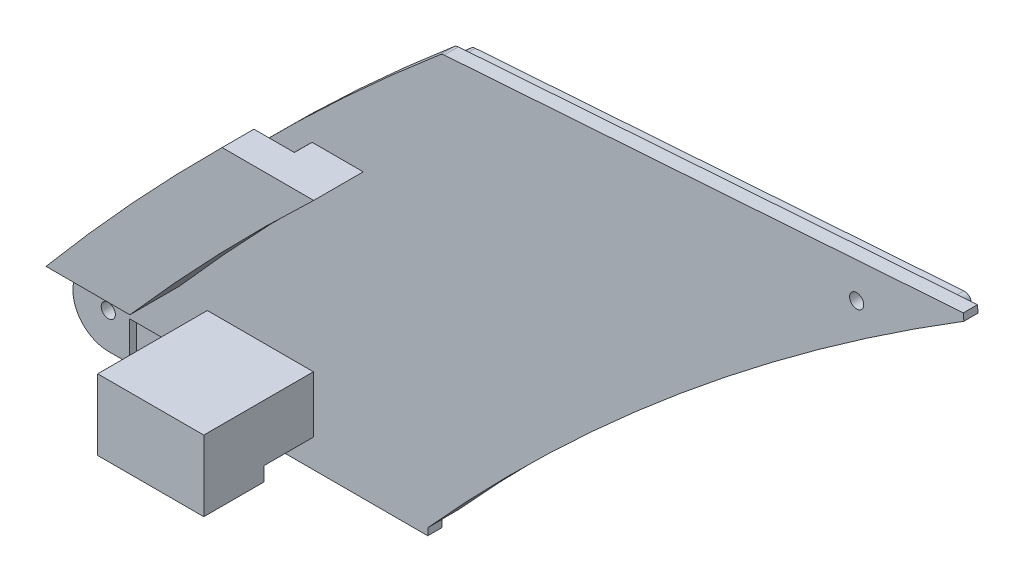
from build123d import *

# Parameters (mm, degrees)
BOSS_EXTRUDE2_DEPTH         = 2
SKETCH7_R                   = 1
BOSS_EXTRUDE3_DEPTH         = 2
FILLET1_R                   = 2
SKETCH8_W                   = 15
SKETCH8_H                   = 8
BOTTOM_SCREWHOLE_PEG_DEPTH  = 15.5
SKETCH12_W                  = 15
SKETCH12_H                  = 8.5
BOTTOM_CLIP_DEPTH           = 2
SKETCH9_W                   = 9
SKETCH9_H                   = 5.5
BUMPER_FEATURE_CUTOUT_DEPTH = 1
FRONT_CLIP_PEG_DEPTH        = 7
FRONT_START                 = -4.5
FRONT_CLIP_DEPTH            = 4.5


with BuildPart() as part:
    # Sketch6 → Boss-Extrude2 (new body)
    with BuildSketch(Plane.XY.offset(2)):
        with BuildLine():
            Line((-47.16876351, -59), (-2.443648629, -59))
            ThreePointArc((-2.443648629, -59), (-2.038405947, -58.914209149), (-1.702695493, -58.671556736))
            ThreePointArc((-1.702695493, -58.671556736), (32.301028127, -25.886609728), (70.398776732, 2.035917408))
            ThreePointArc((70.398776732, 2.035917408), (70.813266743, 3.192601161), (69.793484422, 3.877993962))
            Line((69.793484422, 3.877993962), (0.723267865, -0.951866082))
            ThreePointArc((0.723267865, -0.951866082), (0.415830952, -1.023295613), (0.145969905, -1.186986325))
            ThreePointArc((0.145969905, -1.186986325), (-26.215640884, -25.687788129), (-50.262327585, -52.46428288))
            ThreePointArc((-50.262327585, -52.46428288), (-50.784207361, -56.711305279), (-47.16876351, -59))
        make_face()
        with BuildLine():
            Line((-47.16876351, -58), (-2.443648629, -58))
            ThreePointArc((-2.443648629, -58), (31.656951696, -25.121648584), (69.863240895, 2.880429912))
            Line((69.863240895, 2.880429912), (0.793024339, -1.949430132))
            ThreePointArc((0.793024339, -1.949430132), (-25.502517251, -26.388826418), (-49.488936566, -53.09821216))
            ThreePointArc((-49.488936566, -53.09821216), (-49.880346398, -56.28347896), (-47.16876351, -58))
        make_face(mode=Mode.SUBTRACT)
    extrude(amount=BOSS_EXTRUDE2_DEPTH)

    # Sketch7 → Boss-Extrude3 (add)
    with BuildSketch(Plane.XY.offset(4)):
        with BuildLine():
            Line((73.71668331, 5.154772651), (0.326528995, 0.022833132))
            ThreePointArc((0.326528995, 0.022833132), (0.019473004, -0.048441349), (-0.250141607, -0.211755142))
            ThreePointArc((-0.250141607, -0.211755142), (-26.813414366, -24.869459397), (-51.035718603, -51.8303536))
            ThreePointArc((-51.035718603, -51.8303536), (-51.688068324, -57.139131599), (-47.16876351, -60))
            Line((-47.16876351, -60), (-2, -60))
            Line((-2, -60), (-2, -59))
            ThreePointArc((-2, -59), (33.663262979, -24.745525454), (73.786439783, 4.157208601))
            Line((73.786439783, 4.157208601), (73.71668331, 5.154772651))
        make_face()
        with Locations((58.629217017, -0.912455258)):
            Circle(SKETCH7_R, mode=Mode.SUBTRACT)
        with Locations((-47.16876351, -55)):
            Circle(SKETCH7_R, mode=Mode.SUBTRACT)
    extrude(amount=BOSS_EXTRUDE3_DEPTH)

    # Fillet1
    fillet1_edges = [part.edges().sort_by_distance(p)[0] for p in [
        (-2.443648629, -58, 3),
        (0.793024339, -1.949430132, 3),
        (69.863240895, 2.880429912, 3),
    ]]
    fillet(fillet1_edges, radius=FILLET1_R)

    # Sketch8 → Bottom screwhole peg (add)
    with BuildSketch(Plane.XY.offset(6)):
        with Locations((-25.66876351, -52)):
            Rectangle(SKETCH8_W, SKETCH8_H)
    extrude(amount=BOTTOM_SCREWHOLE_PEG_DEPTH)

    # Sketch12 → Bottom clip (add)
    with BuildSketch(Plane.XZ.offset(56)):
        with Locations((-25.66876351, 17.25)):
            Rectangle(SKETCH12_W, SKETCH12_H)
    extrude(amount=BOTTOM_CLIP_DEPTH)

    # Sketch9 → Bumper feature cutout (cut)
    with BuildSketch(Plane.XY.offset(6)):
        with Locations((-39.66876351, -57.25)):
            Rectangle(SKETCH9_W, SKETCH9_H)
    extrude(amount=-BUMPER_FEATURE_CUTOUT_DEPTH, mode=Mode.SUBTRACT)

    # Sketch10 → Front clip peg (add)
    with BuildSketch(Plane.XY.offset(6)):
        with BuildLine():
            Line((-18.359471103, -20), (-11.126728863, -20))
            ThreePointArc((-11.126728863, -20), (-24.44532195, -33.189587751), (-37.119021504, -47))
            Line((-37.119021504, -47), (-43.730006321, -47))
            ThreePointArc((-43.730006321, -47), (-31.359480765, -33.204252802), (-18.359471103, -20))
        make_face()
    extrude(amount=FRONT_CLIP_PEG_DEPTH)

    # Sketch11 → Front clip (add)
    with BuildSketch(Plane.XY.offset(13).offset(FRONT_START)):
        with BuildLine():
            Line((-43.730006321, -47), (-48.974970821, -47))
            ThreePointArc((-48.974970821, -47), (-36.834401668, -33.215139939), (-24.076037248, -20))
            Line((-24.076037248, -20), (-18.359471103, -20))
            Line((-18.359471103, -20), (-11.126728863, -20))
            ThreePointArc((-11.126728863, -20), (-24.44532195, -33.189587751), (-37.119021504, -47))
            Line((-37.119021504, -47), (-43.730006321, -47))
        make_face()
    extrude(amount=FRONT_CLIP_DEPTH)


solid = part.part
